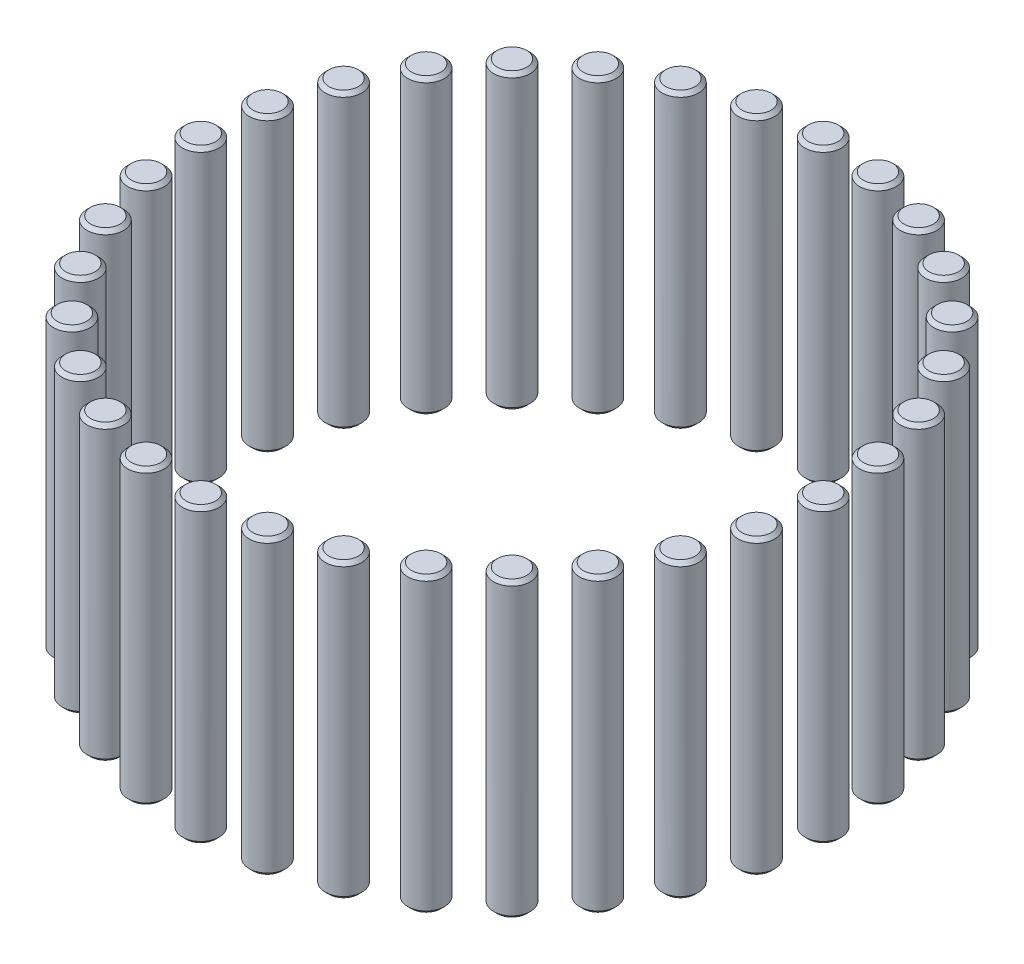
from build123d import *

# Parameters (mm, degrees)
SKETCH1_W         = 0.5
SKETCH1_H         = 8
CHAMFER1_SIZE     = 0.1
CIRPATTERN1_COUNT = 32


with BuildPart() as part:
    # Sketch1 → Revolve1 (revolve)
    with BuildSketch(Plane.XY):
        with Locations((0.25, 4)):
            Rectangle(SKETCH1_W, SKETCH1_H)
    revolve(axis=Axis((0, 8, 0), (0, -1, 0)))

    # Chamfer1
    chamfer1_edges = [part.edges().sort_by_distance(p)[0] for p in [
        (-0.5, 0, 0),
        (-0.5, 8, 0),
    ]]
    chamfer(chamfer1_edges, length=CHAMFER1_SIZE)


with BuildPart() as cirpattern1_1:
    # CirPattern1: pattern copy
    add(part.part.rotate(Axis((0, -14.819817426, 8.5), (0, 1, 0)), 1 * 360 / CIRPATTERN1_COUNT))


with BuildPart() as cirpattern1_2:
    # CirPattern1: pattern copy
    add(part.part.rotate(Axis((0, -14.819817426, 8.5), (0, 1, 0)), 2 * 360 / CIRPATTERN1_COUNT))


with BuildPart() as cirpattern1_3:
    # CirPattern1: pattern copy
    add(part.part.rotate(Axis((0, -14.819817426, 8.5), (0, 1, 0)), 3 * 360 / CIRPATTERN1_COUNT))


with BuildPart() as cirpattern1_4:
    # CirPattern1: pattern copy
    add(part.part.rotate(Axis((0, -14.819817426, 8.5), (0, 1, 0)), 4 * 360 / CIRPATTERN1_COUNT))


with BuildPart() as cirpattern1_5:
    # CirPattern1: pattern copy
    add(part.part.rotate(Axis((0, -14.819817426, 8.5), (0, 1, 0)), 5 * 360 / CIRPATTERN1_COUNT))


with BuildPart() as cirpattern1_6:
    # CirPattern1: pattern copy
    add(part.part.rotate(Axis((0, -14.819817426, 8.5), (0, 1, 0)), 6 * 360 / CIRPATTERN1_COUNT))


with BuildPart() as cirpattern1_7:
    # CirPattern1: pattern copy
    add(part.part.rotate(Axis((0, -14.819817426, 8.5), (0, 1, 0)), 7 * 360 / CIRPATTERN1_COUNT))


with BuildPart() as cirpattern1_8:
    # CirPattern1: pattern copy
    add(part.part.rotate(Axis((0, -14.819817426, 8.5), (0, 1, 0)), 8 * 360 / CIRPATTERN1_COUNT))


with BuildPart() as cirpattern1_9:
    # CirPattern1: pattern copy
    add(part.part.rotate(Axis((0, -14.819817426, 8.5), (0, 1, 0)), 9 * 360 / CIRPATTERN1_COUNT))


with BuildPart() as cirpattern1_10:
    # CirPattern1: pattern copy
    add(part.part.rotate(Axis((0, -14.819817426, 8.5), (0, 1, 0)), 10 * 360 / CIRPATTERN1_COUNT))


with BuildPart() as cirpattern1_11:
    # CirPattern1: pattern copy
    add(part.part.rotate(Axis((0, -14.819817426, 8.5), (0, 1, 0)), 11 * 360 / CIRPATTERN1_COUNT))


with BuildPart() as cirpattern1_12:
    # CirPattern1: pattern copy
    add(part.part.rotate(Axis((0, -14.819817426, 8.5), (0, 1, 0)), 12 * 360 / CIRPATTERN1_COUNT))


with BuildPart() as cirpattern1_13:
    # CirPattern1: pattern copy
    add(part.part.rotate(Axis((0, -14.819817426, 8.5), (0, 1, 0)), 13 * 360 / CIRPATTERN1_COUNT))


with BuildPart() as cirpattern1_14:
    # CirPattern1: pattern copy
    add(part.part.rotate(Axis((0, -14.819817426, 8.5), (0, 1, 0)), 14 * 360 / CIRPATTERN1_COUNT))


with BuildPart() as cirpattern1_15:
    # CirPattern1: pattern copy
    add(part.part.rotate(Axis((0, -14.819817426, 8.5), (0, 1, 0)), 15 * 360 / CIRPATTERN1_COUNT))


with BuildPart() as cirpattern1_16:
    # CirPattern1: pattern copy
    add(part.part.rotate(Axis((0, -14.819817426, 8.5), (0, 1, 0)), 16 * 360 / CIRPATTERN1_COUNT))


with BuildPart() as cirpattern1_17:
    # CirPattern1: pattern copy
    add(part.part.rotate(Axis((0, -14.819817426, 8.5), (0, 1, 0)), 17 * 360 / CIRPATTERN1_COUNT))


with BuildPart() as cirpattern1_18:
    # CirPattern1: pattern copy
    add(part.part.rotate(Axis((0, -14.819817426, 8.5), (0, 1, 0)), 18 * 360 / CIRPATTERN1_COUNT))


with BuildPart() as cirpattern1_19:
    # CirPattern1: pattern copy
    add(part.part.rotate(Axis((0, -14.819817426, 8.5), (0, 1, 0)), 19 * 360 / CIRPATTERN1_COUNT))


with BuildPart() as cirpattern1_20:
    # CirPattern1: pattern copy
    add(part.part.rotate(Axis((0, -14.819817426, 8.5), (0, 1, 0)), 20 * 360 / CIRPATTERN1_COUNT))


with BuildPart() as cirpattern1_21:
    # CirPattern1: pattern copy
    add(part.part.rotate(Axis((0, -14.819817426, 8.5), (0, 1, 0)), 21 * 360 / CIRPATTERN1_COUNT))


with BuildPart() as cirpattern1_22:
    # CirPattern1: pattern copy
    add(part.part.rotate(Axis((0, -14.819817426, 8.5), (0, 1, 0)), 22 * 360 / CIRPATTERN1_COUNT))


with BuildPart() as cirpattern1_23:
    # CirPattern1: pattern copy
    add(part.part.rotate(Axis((0, -14.819817426, 8.5), (0, 1, 0)), 23 * 360 / CIRPATTERN1_COUNT))


with BuildPart() as cirpattern1_24:
    # CirPattern1: pattern copy
    add(part.part.rotate(Axis((0, -14.819817426, 8.5), (0, 1, 0)), 24 * 360 / CIRPATTERN1_COUNT))


with BuildPart() as cirpattern1_25:
    # CirPattern1: pattern copy
    add(part.part.rotate(Axis((0, -14.819817426, 8.5), (0, 1, 0)), 25 * 360 / CIRPATTERN1_COUNT))


with BuildPart() as cirpattern1_26:
    # CirPattern1: pattern copy
    add(part.part.rotate(Axis((0, -14.819817426, 8.5), (0, 1, 0)), 26 * 360 / CIRPATTERN1_COUNT))


with BuildPart() as cirpattern1_27:
    # CirPattern1: pattern copy
    add(part.part.rotate(Axis((0, -14.819817426, 8.5), (0, 1, 0)), 27 * 360 / CIRPATTERN1_COUNT))


with BuildPart() as cirpattern1_28:
    # CirPattern1: pattern copy
    add(part.part.rotate(Axis((0, -14.819817426, 8.5), (0, 1, 0)), 28 * 360 / CIRPATTERN1_COUNT))


with BuildPart() as cirpattern1_29:
    # CirPattern1: pattern copy
    add(part.part.rotate(Axis((0, -14.819817426, 8.5), (0, 1, 0)), 29 * 360 / CIRPATTERN1_COUNT))


with BuildPart() as cirpattern1_30:
    # CirPattern1: pattern copy
    add(part.part.rotate(Axis((0, -14.819817426, 8.5), (0, 1, 0)), 30 * 360 / CIRPATTERN1_COUNT))


with BuildPart() as cirpattern1_31:
    # CirPattern1: pattern copy
    add(part.part.rotate(Axis((0, -14.819817426, 8.5), (0, 1, 0)), 31 * 360 / CIRPATTERN1_COUNT))


solid = Compound([part.part, cirpattern1_1.part, cirpattern1_2.part, cirpattern1_3.part, cirpattern1_4.part, cirpattern1_5.part, cirpattern1_6.part, cirpattern1_7.part, cirpattern1_8.part, cirpattern1_9.part, cirpattern1_10.part, cirpattern1_11.part, cirpattern1_12.part, cirpattern1_13.part, cirpattern1_14.part, cirpattern1_15.part, cirpattern1_16.part, cirpattern1_17.part, cirpattern1_18.part, cirpattern1_19.part, cirpattern1_20.part, cirpattern1_21.part, cirpattern1_22.part, cirpattern1_23.part, cirpattern1_24.part, cirpattern1_25.part, cirpattern1_26.part, cirpattern1_27.part, cirpattern1_28.part, cirpattern1_29.part, cirpattern1_30.part, cirpattern1_31.part])
